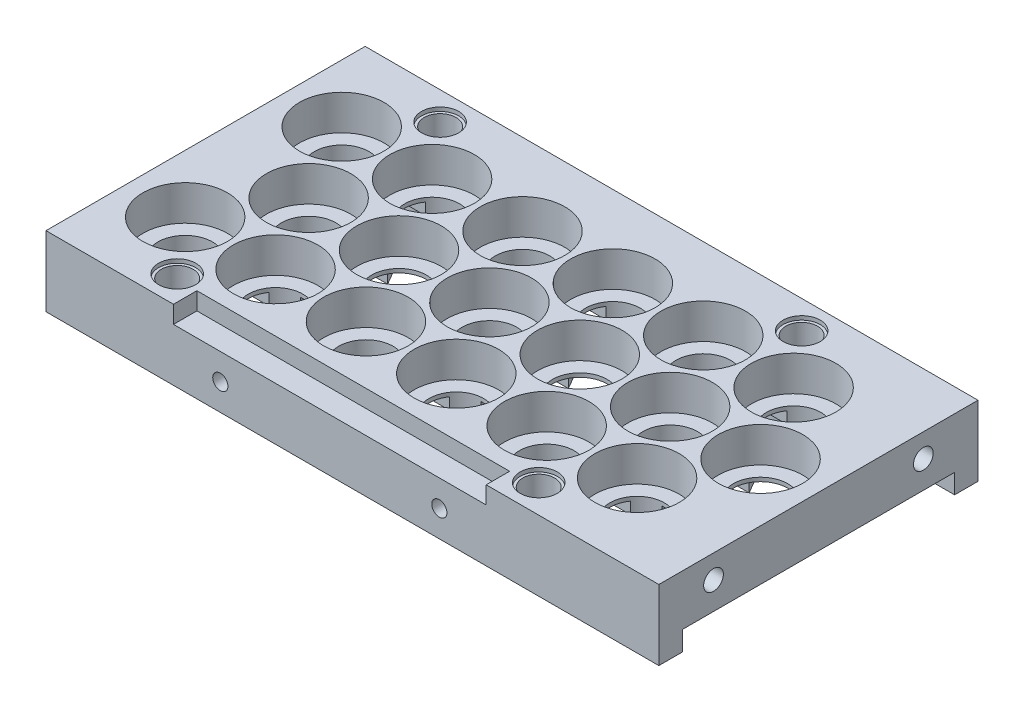
from build123d import *

# Parameters (mm, degrees)
BOSS_EXTRUDE2_DEPTH      = 11
BOSS_EXTRUDE2_DEPTH_BACK = 2
SKETCH1_W                = 156.975
SKETCH1_H                = 81.746976195
SKETCH1_R                = 10.825
BOSS_EXTRUDE3_DEPTH      = 2
BOSS_EXTRUDE3_DEPTH_BACK = 2
SKETCH1_3_R              = 10.825
SKETCH1_3_R_2            = 7
CUT_EXTRUDE3_REACH       = 157.2
SKETCH9_R                = 4.0767
SKETCH10_R               = 4.7625
CUT_EXTRUDE4_DEPTH       = 1
SKETCH13_R               = 6.5
BOSS_EXTRUDE7_DEPTH      = 5
CUT_EXTRUDE1_DEPTH       = 3
SKETCH19_W               = 80.1
SKETCH19_H               = 4.475
CUT_EXTRUDE6_DEPTH       = 6
SKETCH20_R               = 1.9431
CUT_EXTRUDE7_DEPTH       = 3.8862
SKETCH22_R               = 2.525
CUT_EXTRUDE8_DEPTH       = 3.81
SKETCH26_R               = 1.9431
CUT_EXTRUDE9_DEPTH       = 5


with BuildPart() as part:
    # Sketch1 → Boss-Extrude2 (new, two sides: drawn at the far end of the back side and taken through both)
    with BuildSketch(Plane(origin=(0, 0, 0), x_dir=(1, 0, 0), z_dir=(0, 1, 0)).offset(-BOSS_EXTRUDE2_DEPTH_BACK)):
        with Locations((63.6625, -20.048488098)):
            Rectangle(SKETCH1_W, SKETCH1_H)
        with Locations((0, -40.096976195)):
            Circle(SKETCH1_R, mode=Mode.SUBTRACT)
        with Locations((23.15, -40.096976195)):
            Circle(SKETCH1_R, mode=Mode.SUBTRACT)
        with Locations((46.3, -40.096976195)):
            Circle(SKETCH1_R, mode=Mode.SUBTRACT)
        with Locations((69.45, -40.096976195)):
            Circle(SKETCH1_R, mode=Mode.SUBTRACT)
        with Locations((92.6, -40.096976195)):
            Circle(SKETCH1_R, mode=Mode.SUBTRACT)
        with Locations((115.75, -40.096976195)):
            Circle(SKETCH1_R, mode=Mode.SUBTRACT)
        with Locations((11.575, -20.048488098)):
            Circle(SKETCH1_R, mode=Mode.SUBTRACT)
        Circle(SKETCH1_R, mode=Mode.SUBTRACT)
        with Locations((23.15, 0)):
            Circle(SKETCH1_R, mode=Mode.SUBTRACT)
        with Locations((34.725, -20.048488098)):
            Circle(SKETCH1_R, mode=Mode.SUBTRACT)
        with Locations((57.875, -20.048488098)):
            Circle(SKETCH1_R, mode=Mode.SUBTRACT)
        with Locations((46.3, 0)):
            Circle(SKETCH1_R, mode=Mode.SUBTRACT)
        with Locations((81.025, -20.048488098)):
            Circle(SKETCH1_R, mode=Mode.SUBTRACT)
        with Locations((69.45, 0)):
            Circle(SKETCH1_R, mode=Mode.SUBTRACT)
        with Locations((92.6, 0)):
            Circle(SKETCH1_R, mode=Mode.SUBTRACT)
        with Locations((104.175, -20.048488098)):
            Circle(SKETCH1_R, mode=Mode.SUBTRACT)
        with Locations((127.325, -20.048488098)):
            Circle(SKETCH1_R, mode=Mode.SUBTRACT)
        with Locations((115.75, 0)):
            Circle(SKETCH1_R, mode=Mode.SUBTRACT)
    extrude(amount=BOSS_EXTRUDE2_DEPTH + BOSS_EXTRUDE2_DEPTH_BACK)

    # Sketch1<3> → Boss-Extrude3 (add, two sides: drawn at the far end of the back side and taken through both)
    # profile 1 of 18: a face of its own
    with BuildSketch(Plane(origin=(0, 0, 0), x_dir=(1, 0, 0), z_dir=(0, 1, 0)).offset(-BOSS_EXTRUDE3_DEPTH_BACK)):
        Circle(SKETCH1_3_R)
        Circle(SKETCH1_3_R_2, mode=Mode.SUBTRACT)
    # profile 2 of 18: a face of its own
    with BuildSketch(Plane(origin=(0, 0, 0), x_dir=(1, 0, 0), z_dir=(0, 1, 0)).offset(-BOSS_EXTRUDE3_DEPTH_BACK)):
        with Locations((11.575, -20.048488098)):
            Circle(SKETCH1_3_R)
        with Locations((11.575, -20.048488098)):
            Circle(SKETCH1_3_R_2, mode=Mode.SUBTRACT)
    # profile 3 of 18: a face of its own
    with BuildSketch(Plane(origin=(0, 0, 0), x_dir=(1, 0, 0), z_dir=(0, 1, 0)).offset(-BOSS_EXTRUDE3_DEPTH_BACK)):
        with Locations((0, -40.096976195)):
            Circle(SKETCH1_3_R)
        with Locations((0, -40.096976195)):
            Circle(SKETCH1_3_R_2, mode=Mode.SUBTRACT)
    # profile 4 of 18: a face of its own
    with BuildSketch(Plane(origin=(0, 0, 0), x_dir=(1, 0, 0), z_dir=(0, 1, 0)).offset(-BOSS_EXTRUDE3_DEPTH_BACK)):
        with Locations((23.15, 0)):
            Circle(SKETCH1_3_R)
        with Locations((23.15, 0)):
            Circle(SKETCH1_3_R_2, mode=Mode.SUBTRACT)
    # profile 5 of 18: a face of its own
    with BuildSketch(Plane(origin=(0, 0, 0), x_dir=(1, 0, 0), z_dir=(0, 1, 0)).offset(-BOSS_EXTRUDE3_DEPTH_BACK)):
        with Locations((34.725, -20.048488098)):
            Circle(SKETCH1_3_R)
        with Locations((34.725, -20.048488098)):
            Circle(SKETCH1_3_R_2, mode=Mode.SUBTRACT)
    # profile 6 of 18: a face of its own
    with BuildSketch(Plane(origin=(0, 0, 0), x_dir=(1, 0, 0), z_dir=(0, 1, 0)).offset(-BOSS_EXTRUDE3_DEPTH_BACK)):
        with Locations((23.15, -40.096976195)):
            Circle(SKETCH1_3_R)
        with Locations((23.15, -40.096976195)):
            Circle(SKETCH1_3_R_2, mode=Mode.SUBTRACT)
    # profile 7 of 18: a face of its own
    with BuildSketch(Plane(origin=(0, 0, 0), x_dir=(1, 0, 0), z_dir=(0, 1, 0)).offset(-BOSS_EXTRUDE3_DEPTH_BACK)):
        with Locations((46.3, 0)):
            Circle(SKETCH1_3_R)
        with Locations((46.3, 0)):
            Circle(SKETCH1_3_R_2, mode=Mode.SUBTRACT)
    # profile 8 of 18: a face of its own
    with BuildSketch(Plane(origin=(0, 0, 0), x_dir=(1, 0, 0), z_dir=(0, 1, 0)).offset(-BOSS_EXTRUDE3_DEPTH_BACK)):
        with Locations((57.875, -20.048488098)):
            Circle(SKETCH1_3_R)
        with Locations((57.875, -20.048488098)):
            Circle(SKETCH1_3_R_2, mode=Mode.SUBTRACT)
    # profile 9 of 18: a face of its own
    with BuildSketch(Plane(origin=(0, 0, 0), x_dir=(1, 0, 0), z_dir=(0, 1, 0)).offset(-BOSS_EXTRUDE3_DEPTH_BACK)):
        with Locations((46.3, -40.096976195)):
            Circle(SKETCH1_3_R)
        with Locations((46.3, -40.096976195)):
            Circle(SKETCH1_3_R_2, mode=Mode.SUBTRACT)
    # profile 10 of 18: a face of its own
    with BuildSketch(Plane(origin=(0, 0, 0), x_dir=(1, 0, 0), z_dir=(0, 1, 0)).offset(-BOSS_EXTRUDE3_DEPTH_BACK)):
        with Locations((69.45, 0)):
            Circle(SKETCH1_3_R)
        with Locations((69.45, 0)):
            Circle(SKETCH1_3_R_2, mode=Mode.SUBTRACT)
    # profile 11 of 18: a face of its own
    with BuildSketch(Plane(origin=(0, 0, 0), x_dir=(1, 0, 0), z_dir=(0, 1, 0)).offset(-BOSS_EXTRUDE3_DEPTH_BACK)):
        with Locations((81.025, -20.048488098)):
            Circle(SKETCH1_3_R)
        with Locations((81.025, -20.048488098)):
            Circle(SKETCH1_3_R_2, mode=Mode.SUBTRACT)
    # profile 12 of 18: a face of its own
    with BuildSketch(Plane(origin=(0, 0, 0), x_dir=(1, 0, 0), z_dir=(0, 1, 0)).offset(-BOSS_EXTRUDE3_DEPTH_BACK)):
        with Locations((69.45, -40.096976195)):
            Circle(SKETCH1_3_R)
        with Locations((69.45, -40.096976195)):
            Circle(SKETCH1_3_R_2, mode=Mode.SUBTRACT)
    # profile 13 of 18: a face of its own
    with BuildSketch(Plane(origin=(0, 0, 0), x_dir=(1, 0, 0), z_dir=(0, 1, 0)).offset(-BOSS_EXTRUDE3_DEPTH_BACK)):
        with Locations((92.6, 0)):
            Circle(SKETCH1_3_R)
        with Locations((92.6, 0)):
            Circle(SKETCH1_3_R_2, mode=Mode.SUBTRACT)
    # profile 14 of 18: a face of its own
    with BuildSketch(Plane(origin=(0, 0, 0), x_dir=(1, 0, 0), z_dir=(0, 1, 0)).offset(-BOSS_EXTRUDE3_DEPTH_BACK)):
        with Locations((104.175, -20.048488098)):
            Circle(SKETCH1_3_R)
        with Locations((104.175, -20.048488098)):
            Circle(SKETCH1_3_R_2, mode=Mode.SUBTRACT)
    # profile 15 of 18: a face of its own
    with BuildSketch(Plane(origin=(0, 0, 0), x_dir=(1, 0, 0), z_dir=(0, 1, 0)).offset(-BOSS_EXTRUDE3_DEPTH_BACK)):
        with Locations((92.6, -40.096976195)):
            Circle(SKETCH1_3_R)
        with Locations((92.6, -40.096976195)):
            Circle(SKETCH1_3_R_2, mode=Mode.SUBTRACT)
    # profile 16 of 18: a face of its own
    with BuildSketch(Plane(origin=(0, 0, 0), x_dir=(1, 0, 0), z_dir=(0, 1, 0)).offset(-BOSS_EXTRUDE3_DEPTH_BACK)):
        with Locations((115.75, 0)):
            Circle(SKETCH1_3_R)
        with Locations((115.75, 0)):
            Circle(SKETCH1_3_R_2, mode=Mode.SUBTRACT)
    # profile 17 of 18: a face of its own
    with BuildSketch(Plane(origin=(0, 0, 0), x_dir=(1, 0, 0), z_dir=(0, 1, 0)).offset(-BOSS_EXTRUDE3_DEPTH_BACK)):
        with Locations((127.325, -20.048488098)):
            Circle(SKETCH1_3_R)
        with Locations((127.325, -20.048488098)):
            Circle(SKETCH1_3_R_2, mode=Mode.SUBTRACT)
    # profile 18 of 18: a face of its own
    with BuildSketch(Plane(origin=(0, 0, 0), x_dir=(1, 0, 0), z_dir=(0, 1, 0)).offset(-BOSS_EXTRUDE3_DEPTH_BACK)):
        with Locations((115.75, -40.096976195)):
            Circle(SKETCH1_3_R)
        with Locations((115.75, -40.096976195)):
            Circle(SKETCH1_3_R_2, mode=Mode.SUBTRACT)
    extrude(amount=BOSS_EXTRUDE3_DEPTH + BOSS_EXTRUDE3_DEPTH_BACK)

    # Sketch9 → Cut-Extrude3 (cut, up to next)
    with BuildSketch(Plane(origin=(0, 11, 0), x_dir=(1, 0, 0), z_dir=(0, 1, 0)), mode=Mode.PRIVATE) as cut_extrude3_sk1:
        with Locations((11.575, 13.625)):
            Circle(SKETCH9_R)
    cut_extrude3_tool1 = extrude(cut_extrude3_sk1.sketch, amount=-CUT_EXTRUDE3_REACH, mode=Mode.PRIVATE) & part.part
    # Sketch9 → Cut-Extrude3 (cut, up to next)
    with BuildSketch(Plane(origin=(0, 11, 0), x_dir=(1, 0, 0), z_dir=(0, 1, 0)), mode=Mode.PRIVATE) as cut_extrude3_sk2:
        with Locations((11.575, -53.721976195)):
            Circle(SKETCH9_R)
    cut_extrude3_tool2 = extrude(cut_extrude3_sk2.sketch, amount=-CUT_EXTRUDE3_REACH, mode=Mode.PRIVATE) & part.part
    # Sketch9 → Cut-Extrude3 (cut, up to next)
    with BuildSketch(Plane(origin=(0, 11, 0), x_dir=(1, 0, 0), z_dir=(0, 1, 0)), mode=Mode.PRIVATE) as cut_extrude3_sk3:
        with Locations((104.175, -53.721976195)):
            Circle(SKETCH9_R)
    cut_extrude3_tool3 = extrude(cut_extrude3_sk3.sketch, amount=-CUT_EXTRUDE3_REACH, mode=Mode.PRIVATE) & part.part
    # Sketch9 → Cut-Extrude3 (cut, up to next)
    with BuildSketch(Plane(origin=(0, 11, 0), x_dir=(1, 0, 0), z_dir=(0, 1, 0)), mode=Mode.PRIVATE) as cut_extrude3_sk4:
        with Locations((104.175, 13.625)):
            Circle(SKETCH9_R)
    cut_extrude3_tool4 = extrude(cut_extrude3_sk4.sketch, amount=-CUT_EXTRUDE3_REACH, mode=Mode.PRIVATE) & part.part
    add(cut_extrude3_tool1.solids().sort_by_distance((11.575, 11, -13.625))[0], mode=Mode.SUBTRACT)
    add(cut_extrude3_tool2.solids().sort_by_distance((11.575, 11, 53.721976))[0], mode=Mode.SUBTRACT)
    add(cut_extrude3_tool3.solids().sort_by_distance((104.175, 11, 53.721976))[0], mode=Mode.SUBTRACT)
    add(cut_extrude3_tool4.solids().sort_by_distance((104.175, 11, -13.625))[0], mode=Mode.SUBTRACT)

    # Sketch10 → Cut-Extrude4 (cut)
    with BuildSketch(Plane(origin=(0, 11, 0), x_dir=(1, 0, 0), z_dir=(0, 1, 0))):
        with Locations((11.575, 13.625)):
            Circle(SKETCH10_R)
        with Locations((104.175, 13.625)):
            Circle(SKETCH10_R)
        with Locations((104.175, -53.721976195)):
            Circle(SKETCH10_R)
        with Locations((11.575, -53.721976195)):
            Circle(SKETCH10_R)
    extrude(amount=-CUT_EXTRUDE4_DEPTH, mode=Mode.SUBTRACT)

    # Sketch13 → Boss-Extrude7 (add)
    # profile 1 of 2: a face of its own
    with BuildSketch(Plane.XZ.offset(2)):
        with BuildLine():
            ThreePointArc((3.665512027, 54.921976195), (11.575, 45.721976195), (19.484487973, 54.921976195))
            Line((19.484487973, 54.921976195), (96.265512027, 54.921976195))
            ThreePointArc((96.265512027, 54.921976195), (104.175, 45.721976195), (112.084487973, 54.921976195))
            Line((112.084487973, 54.921976195), (142.15, 54.921976195))
            Line((142.15, 54.921976195), (142.15, 60.921976195))
            Line((142.15, 60.921976195), (-14.825, 60.921976195))
            Line((-14.825, 60.921976195), (-14.825, 54.921976195))
            Line((-14.825, 54.921976195), (3.665512027, 54.921976195))
        make_face()
        with Locations((11.575, 53.721976195)):
            Circle(SKETCH13_R, mode=Mode.SUBTRACT)
        with Locations((104.175, 53.721976195)):
            Circle(SKETCH13_R, mode=Mode.SUBTRACT)
    # profile 2 of 2: a face of its own
    with BuildSketch(Plane.XZ.offset(2)):
        with BuildLine():
            Line((-14.825, -14.825), (-14.825, -20.825))
            Line((-14.825, -20.825), (142.15, -20.825))
            Line((142.15, -20.825), (142.15, -14.825))
            Line((142.15, -14.825), (112.084487973, -14.825))
            ThreePointArc((112.084487973, -14.825), (104.175, -5.625), (96.265512027, -14.825))
            Line((96.265512027, -14.825), (19.484487973, -14.825))
            ThreePointArc((19.484487973, -14.825), (11.575, -5.625), (3.665512027, -14.825))
            Line((3.665512027, -14.825), (-14.825, -14.825))
        make_face()
        with Locations((11.575, -13.625)):
            Circle(SKETCH13_R, mode=Mode.SUBTRACT)
        with Locations((104.175, -13.625)):
            Circle(SKETCH13_R, mode=Mode.SUBTRACT)
    extrude(amount=BOSS_EXTRUDE7_DEPTH)

    # Sketch2 → Cut-Extrude1 (cut)
    with BuildSketch(Plane.XZ.offset(2)):
        with BuildLine():
            Line((23.15, 44.096976195), (0, 44.096976195))
            ThreePointArc((0, 44.096976195), (-4, 40.096976195), (0, 36.096976195))
            Line((0, 36.096976195), (20.840598923, 36.096976195))
            Line((20.840598923, 36.096976195), (27.79679677, 24.048488098))
            Line((27.79679677, 24.048488098), (13.884401077, 24.048488098))
            Line((13.884401077, 24.048488098), (15.039101615, 22.048488098))
            ThreePointArc((15.039101615, 22.048488098), (15.575, 20.048488098), (15.039101615, 18.048488098))
            Line((15.039101615, 18.048488098), (13.884401077, 16.048488098))
            Line((13.884401077, 16.048488098), (27.79679677, 16.048488098))
            Line((27.79679677, 16.048488098), (20.840598923, 4))
            Line((20.840598923, 4), (0, 4))
            ThreePointArc((0, 4), (-4, 0), (0, -4))
            Line((0, -4), (23.14999999, -4))
            ThreePointArc((23.14999999, -4), (25.149999995, -3.464101618), (26.614101615, -2))
            Line((26.614101615, -2), (37.034401077, 16.048488098))
            Line((37.034401077, 16.048488098), (34.725, 16.048488098))
            ThreePointArc((34.725, 16.048488098), (32.725, 16.584386482), (31.260898385, 18.048488098))
            Line((31.260898385, 18.048488098), (30.106197846, 20.048488098))
            Line((30.106197846, 20.048488098), (31.260898385, 22.048488098))
            ThreePointArc((31.260898385, 22.048488098), (32.725, 23.512589713), (34.725, 24.048488098))
            Line((34.725, 24.048488098), (37.034401077, 24.048488098))
            Line((37.034401077, 24.048488098), (26.614101615, 42.096976195))
            ThreePointArc((26.614101615, 42.096976195), (25.15, 43.56107781), (23.15, 44.096976195))
        make_face()
        with BuildLine():
            Line((69.45, 44.096976195), (46.3, 44.096976195))
            ThreePointArc((46.3, 44.096976195), (42.835898385, 42.096976195), (42.835898385, 38.096976195))
            Line((42.835898385, 38.096976195), (43.990598923, 36.096976195))
            Line((43.990598923, 36.096976195), (67.140598923, 36.096976195))
            Line((67.140598923, 36.096976195), (74.09679677, 24.048488098))
            Line((74.09679677, 24.048488098), (60.184401077, 24.048488098))
            Line((60.184401077, 24.048488098), (61.339101615, 22.048488098))
            ThreePointArc((61.339101615, 22.048488098), (61.875, 20.048488098), (61.339101615, 18.048488098))
            Line((61.339101615, 18.048488098), (60.184401077, 16.048488098))
            Line((60.184401077, 16.048488098), (74.09679677, 16.048488098))
            Line((74.09679677, 16.048488098), (67.140598923, 4))
            Line((67.140598923, 4), (43.990598923, 4))
            Line((43.990598923, 4), (42.835898385, 2))
            ThreePointArc((42.835898385, 2), (42.835898385, -2), (46.3, -4))
            Line((46.3, -4), (69.45, -4))
            ThreePointArc((69.45, -4), (71.45, -3.464101615), (72.914101615, -2))
            Line((72.914101615, -2), (83.334401077, 16.048488098))
            Line((83.334401077, 16.048488098), (81.025, 16.048488098))
            ThreePointArc((81.025, 16.048488098), (79.025, 16.584386482), (77.560898385, 18.048488098))
            Line((77.560898385, 18.048488098), (76.406197846, 20.048488098))
            Line((76.406197846, 20.048488098), (77.560898385, 22.048488098))
            ThreePointArc((77.560898385, 22.048488098), (79.025, 23.512589713), (81.025, 24.048488098))
            Line((81.025, 24.048488098), (83.334401077, 24.048488098))
            Line((83.334401077, 24.048488098), (72.914101615, 42.096976195))
            ThreePointArc((72.914101615, 42.096976195), (71.45, 43.56107781), (69.45, 44.096976195))
        make_face()
        with BuildLine():
            Line((115.75, 44.096976195), (92.6, 44.096976195))
            ThreePointArc((92.6, 44.096976195), (89.135898385, 42.096976195), (89.135898385, 38.096976195))
            Line((89.135898385, 38.096976195), (90.290598923, 36.096976195))
            Line((90.290598923, 36.096976195), (113.440598923, 36.096976195))
            Line((113.440598923, 36.096976195), (112.285898385, 38.096976195))
            ThreePointArc((112.285898385, 38.096976195), (112.285898385, 42.096976195), (115.75, 44.096976195))
        make_face()
        with BuildLine():
            Line((130.789101615, 22.048488098), (119.214101615, 42.096976195))
            ThreePointArc((119.214101615, 42.096976195), (119.214101615, 38.096976195), (115.75, 36.096976195))
            Line((115.75, 36.096976195), (113.440598923, 36.096976195))
            Line((113.440598923, 36.096976195), (120.39679677, 24.048488098))
            Line((120.39679677, 24.048488098), (106.484401077, 24.048488098))
            Line((106.484401077, 24.048488098), (107.639101615, 22.048488098))
            ThreePointArc((107.639101615, 22.048488098), (108.175, 20.048488098), (107.639101615, 18.048488098))
            Line((107.639101615, 18.048488098), (106.484401077, 16.048488098))
            Line((106.484401077, 16.048488098), (120.39679677, 16.048488098))
            Line((120.39679677, 16.048488098), (113.440598923, 4))
            Line((113.440598923, 4), (115.75, 4))
            ThreePointArc((115.75, 4), (119.214101615, 2), (119.214101615, -2))
            Line((119.214101615, -2), (130.789101615, 18.048488098))
            ThreePointArc((130.789101615, 18.048488098), (127.325, 16.048488098), (123.860898385, 18.048488098))
            Line((123.860898385, 18.048488098), (122.706197846, 20.048488098))
            Line((122.706197846, 20.048488098), (123.860898385, 22.048488098))
            ThreePointArc((123.860898385, 22.048488098), (127.325, 24.048488098), (130.789101615, 22.048488098))
        make_face()
        with BuildLine():
            Line((113.440598923, 4), (90.290598923, 4))
            Line((90.290598923, 4), (89.135898385, 2))
            ThreePointArc((89.135898385, 2), (89.135898385, -2), (92.6, -4))
            Line((92.6, -4), (115.75, -4))
            ThreePointArc((115.75, -4), (112.285898385, -2), (112.285898385, 2))
            Line((112.285898385, 2), (113.440598923, 4))
        make_face()
    extrude(amount=-CUT_EXTRUDE1_DEPTH, mode=Mode.SUBTRACT)

    # Sketch19 → Cut-Extrude6 (cut)
    with BuildSketch(Plane.XY.offset(60.921976195)):
        with Locations((57.875, 8.7625)):
            Rectangle(SKETCH19_W, SKETCH19_H)
    extrude(amount=-CUT_EXTRUDE6_DEPTH, mode=Mode.SUBTRACT)

    # Sketch20 → Cut-Extrude7 (cut)
    with BuildSketch(Plane.XY.offset(60.921976195)):
        with Locations((29.825, -0.2375)):
            Circle(SKETCH20_R)
        with Locations((85.925, -0.2375)):
            Circle(SKETCH20_R)
    extrude(amount=-CUT_EXTRUDE7_DEPTH, mode=Mode.SUBTRACT)

    # Sketch22 → Cut-Extrude8 (cut)
    with BuildSketch(Plane(origin=(142.15, 0, 0), x_dir=(0, 0, -1), z_dir=(1, 0, 0))):
        with Locations((-46.921976195, 5)):
            Circle(SKETCH22_R)
        with Locations((6.825, 5)):
            Circle(SKETCH22_R)
    extrude(amount=-CUT_EXTRUDE8_DEPTH, mode=Mode.SUBTRACT)

    # Sketch26 → Cut-Extrude9 (cut)
    with BuildSketch(Plane.XZ.offset(2)):
        with Locations((132.15, -9.4125)):
            Circle(SKETCH26_R)
        with Locations((57.875, -9.4125)):
            Circle(SKETCH26_R)
        with Locations((-10.825, -9.4125)):
            Circle(SKETCH26_R)
        with Locations((-10.825, 49.509476195)):
            Circle(SKETCH26_R)
        with Locations((57.875, 49.509476195)):
            Circle(SKETCH26_R)
        with Locations((132.15, 49.509476195)):
            Circle(SKETCH26_R)
    extrude(amount=-CUT_EXTRUDE9_DEPTH, mode=Mode.SUBTRACT)


solid = part.part
